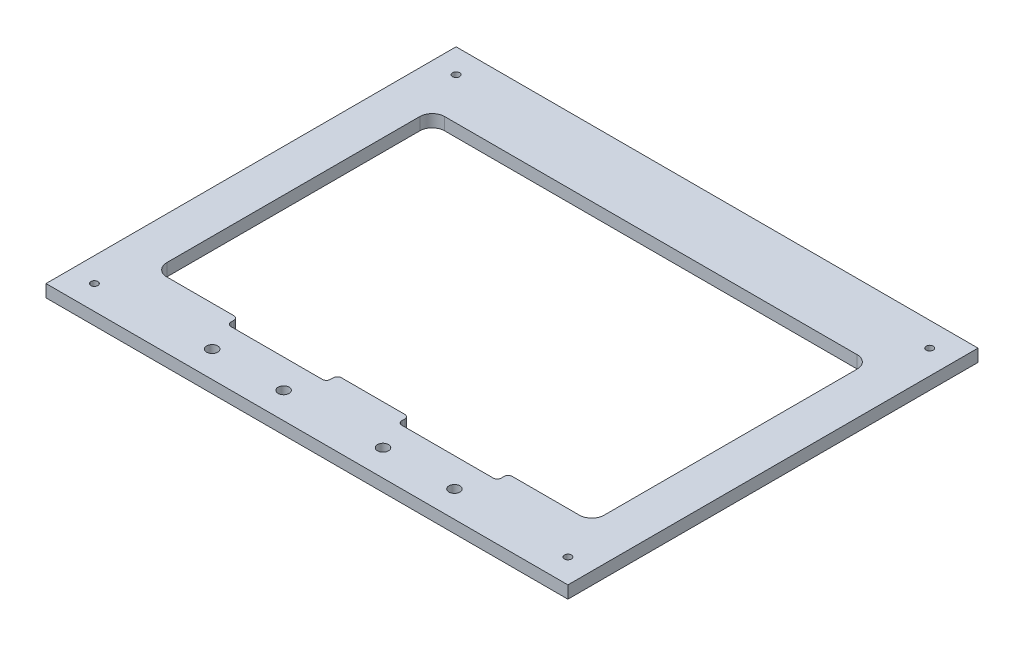
from build123d import *

# Parameters (mm, degrees)
SKETCH1_W              = 266.7
SKETCH1_H              = 209.55
BOSS_EXTRUDE1_DEPTH    = 6.35
M3_CLEARANCE_HOLE1_D   = 3.6
SKETCH4_W              = 223.52
SKETCH4_H              = 141.986
CUT_EXTRUDE1_DEPTH     = 170.706645789
F_10_CLEARANCE_HOLE1_D = 5.6134
SKETCH7_W              = 50.8
SKETCH7_H              = 5.588
CUT_EXTRUDE2_DEPTH     = 170.706645789
FILLET1_R              = 6.35
FILLET2_R              = 2.032


with BuildPart() as part:
    # Sketch1 → Boss-Extrude1 (new body)
    with BuildSketch(Plane(origin=(0, 0, 0), x_dir=(1, 0, 0), z_dir=(0, 1, 0))):
        Rectangle(SKETCH1_W, SKETCH1_H)
    extrude(amount=BOSS_EXTRUDE1_DEPTH)

    # M3 Clearance Hole1 (through all)
    with Locations(Plane(origin=(0, 6.35, 0), x_dir=(1, 0, 0), z_dir=(0, 1, 0))):
        with Locations((121.0056, -92.4306), (-121.0056, -92.4306), (-121.0056, 92.4306), (121.0056, 92.4306)):
            Hole(M3_CLEARANCE_HOLE1_D / 2)

    # Sketch4 → Cut-Extrude1 (cut, through all)
    with BuildSketch(Plane(origin=(0, 6.35, 0), x_dir=(1, 0, 0), z_dir=(0, 1, 0))):
        Rectangle(SKETCH4_W, SKETCH4_H)
    extrude(amount=-CUT_EXTRUDE1_DEPTH, mode=Mode.SUBTRACT)

    # #10 Clearance Hole1 (through all)
    with Locations(Plane(origin=(0, 6.35, 0), x_dir=(1, 0, 0), z_dir=(0, 1, 0))):
        with Locations((-61.9125, -91.313), (-25.4, -91.313), (25.4, -91.313), (61.9125, -91.313)):
            Hole(F_10_CLEARANCE_HOLE1_D / 2)

    # Sketch7 → Cut-Extrude2 (cut, through all)
    with BuildSketch(Plane(origin=(0, 6.35, 0), x_dir=(1, 0, 0), z_dir=(0, 1, 0))):
        with Locations((-43.65625, -73.787)):
            Rectangle(SKETCH7_W, SKETCH7_H)
        with Locations((43.65625, -73.787)):
            Rectangle(SKETCH7_W, SKETCH7_H)
    extrude(amount=-CUT_EXTRUDE2_DEPTH, mode=Mode.SUBTRACT)

    # Fillet1
    fillet1_edges = [part.edges().sort_by_distance(p)[0] for p in [
        (111.76, 3.175, -70.993),
        (111.76, 3.175, 70.993),
        (-111.76, 3.175, 70.993),
        (-111.76, 3.175, -70.993),
    ]]
    fillet(fillet1_edges, radius=FILLET1_R)

    # Fillet2
    fillet2_edges = [part.edges().sort_by_distance(p)[0] for p in [
        (69.05625, 3.175, 70.993),
        (69.05625, 3.175, 76.581),
        (18.25625, 3.175, 76.581),
        (18.25625, 3.175, 70.993),
        (-18.25625, 3.175, 70.993),
        (-18.25625, 3.175, 76.581),
        (-69.05625, 3.175, 70.993),
        (-69.05625, 3.175, 76.581),
    ]]
    fillet(fillet2_edges, radius=FILLET2_R)


solid = part.part
